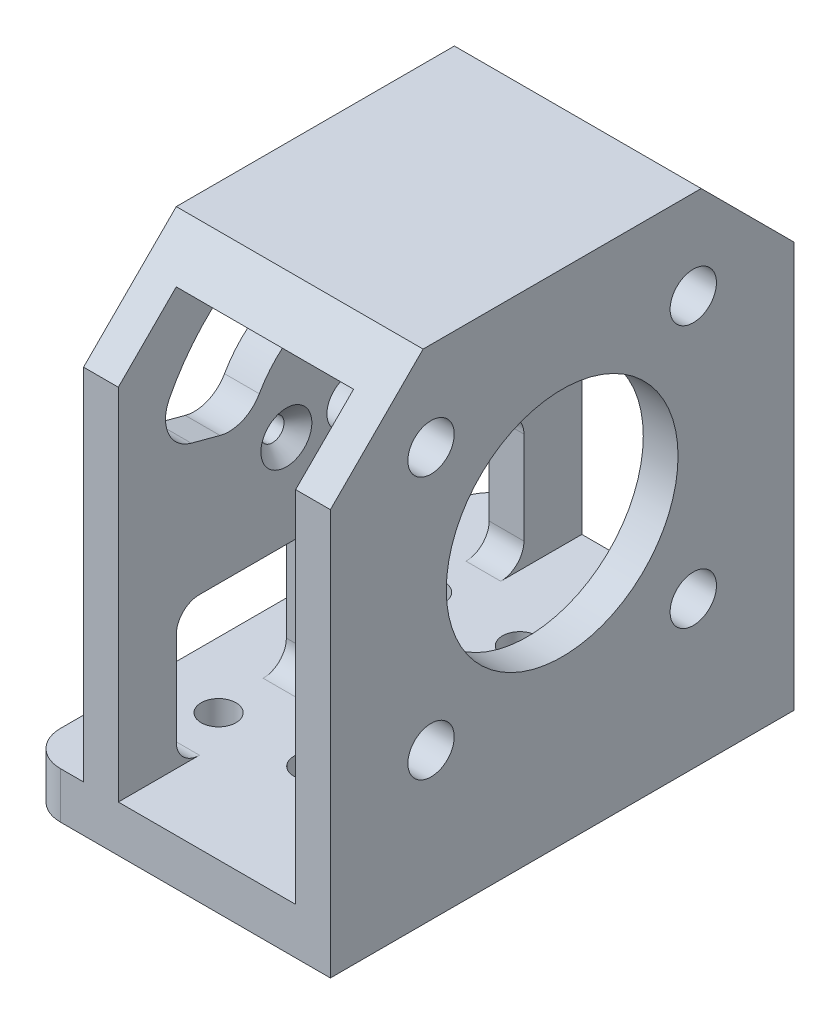
from build123d import *

# Parameters (mm, degrees)
SKETCH_1_W          = 21.3
SKETCH_1_H          = 40
EXTRUDE_1_DEPTH     = 4
SKETCH_2_W          = 3
SKETCH_2_H          = 40
EXTRUDE_2_DEPTH     = 36
SKETCH_3_W          = 21.3
SKETCH_3_H          = 40
EXTRUDE_3_DEPTH     = 3
CUT_EXTRUDE_1_REACH = 53.987
SKETCH_4_R          = 10
CUT_EXTRUDE_2_DEPTH = 52.98740232
SKETCH_13_W         = 40
SKETCH_13_H         = 4
EXTRUDE_4_DEPTH     = 5
SKETCH_6_R          = 1.5
CUT_EXTRUDE_3_DEPTH = 47.539472494
SKETCH_7_R          = 2
CUT_EXTRUDE_4_DEPTH = 4
SKETCH_9_R          = 2
SKETCH_9_R_2        = 1
CUT_EXTRUDE_6_DEPTH = 4
CUT_EXTRUDE_7_DEPTH = 4
FILLET_1_R          = 3
SKETCH_11_W         = 12.5
SKETCH_11_H         = 12
CUT_EXTRUDE_8_DEPTH = 3
FILLET_2_R          = 2
SKETCH_12_R         = 1
CUT_EXTRUDE_9_DEPTH = 3
CHAMFER_1_SIZE      = 1.2
FILLET_3_R          = 3


with BuildPart() as part:
    # 草图1 → 凸台-拉伸1 (new body)
    with BuildSketch(Plane(origin=(0, 0, 0), x_dir=(1, 0, 0), z_dir=(0, 1, 0))):
        Rectangle(SKETCH_1_W, SKETCH_1_H)
    extrude(amount=EXTRUDE_1_DEPTH)

    # 草图2 → 凸台-拉伸2 (add)
    with BuildSketch(Plane(origin=(0, 4, 0), x_dir=(1, 0, 0), z_dir=(0, 1, 0))):
        with Locations((-9.15, 0)):
            Rectangle(SKETCH_2_W, SKETCH_2_H)
        with Locations((9.15, 0)):
            Rectangle(SKETCH_2_W, SKETCH_2_H)
    extrude(amount=EXTRUDE_2_DEPTH)

    # 草图3 → 凸台-拉伸3 (add)
    with BuildSketch(Plane(origin=(0, 40, 0), x_dir=(1, 0, 0), z_dir=(0, 1, 0))):
        Rectangle(SKETCH_3_W, SKETCH_3_H)
    extrude(amount=EXTRUDE_3_DEPTH)

    # 草图4 → 切除-拉伸1 (cut, up to next)
    with BuildSketch(Plane(origin=(10.65, 0, 0), x_dir=(0, 0, -1), z_dir=(1, 0, 0)), mode=Mode.PRIVATE) as cut_extrude_1_sk1:
        with Locations((0, 24)):
            Circle(SKETCH_4_R)
    cut_extrude_1_tool1 = extrude(cut_extrude_1_sk1.sketch, amount=-CUT_EXTRUDE_1_REACH, mode=Mode.PRIVATE) & part.part
    add(cut_extrude_1_tool1.solids().sort_by_distance((10.65, 24, 0))[0], mode=Mode.SUBTRACT)

    # 草图5 → 切除-拉伸2 (cut, through all)
    with BuildSketch(Plane(origin=(10.65, 0, 0), x_dir=(0, 0, -1), z_dir=(1, 0, 0))):
        Polygon((-20, 35), (-12, 43), (-20, 43), align=None)
        Polygon((20, 35), (20, 43), (12, 43), align=None)
    extrude(amount=-CUT_EXTRUDE_2_DEPTH, mode=Mode.SUBTRACT)

    # 草图13 → 凸台-拉伸4 (add)
    with BuildSketch(Plane.ZY.offset(10.65)):
        with Locations((0, 2)):
            Rectangle(SKETCH_13_W, SKETCH_13_H)
    extrude(amount=EXTRUDE_4_DEPTH)

    # 草图6 → 切除-拉伸3 (cut, through all)
    with BuildSketch(Plane(origin=(0, 4, 0), x_dir=(1, 0, 0), z_dir=(0, 1, 0))):
        with Locations(Location((-10, 9, 0), (0, 0, 270))):
            Circle(SKETCH_6_R)
        with Locations(Location((-2, 9, 0), (0, 0, 90))):
            Circle(SKETCH_6_R)
        with Locations(Location((-2, -9, 0), (0, 0, 270))):
            Circle(SKETCH_6_R)
        with Locations(Location((-10, -9, 0), (0, 0, 244.320711381))):
            Circle(SKETCH_6_R)
    extrude(amount=-CUT_EXTRUDE_3_DEPTH, mode=Mode.SUBTRACT)

    # 草图7 → 切除-拉伸4 (cut)
    with BuildSketch(Plane(origin=(10.65, 0, 0), x_dir=(0, 0, -1), z_dir=(1, 0, 0))):
        with Locations((-11.313708499, 35.313708499)):
            Circle(SKETCH_7_R)
        with Locations((11.313708499, 35.313708499)):
            Circle(SKETCH_7_R)
        with Locations((11.313708499, 12.686291501)):
            Circle(SKETCH_7_R)
        with Locations((-11.313708499, 12.686291501)):
            Circle(SKETCH_7_R)
    extrude(amount=-CUT_EXTRUDE_4_DEPTH, mode=Mode.SUBTRACT)

    # 草图9 → 切除-拉伸6 (cut)
    with BuildSketch(Plane.ZY.offset(10.65)):
        with Locations((0, 24)):
            Circle(SKETCH_9_R)
        with Locations((-5.5, 24)):
            Circle(SKETCH_9_R_2)
        with Locations((5.5, 24)):
            Circle(SKETCH_9_R_2)
    extrude(amount=-CUT_EXTRUDE_6_DEPTH, mode=Mode.SUBTRACT)

    # 草图10 → 切除-拉伸7 (cut)
    with BuildSketch(Plane.ZY.offset(10.65)):
        with BuildLine():
            Line((-2.329371406, 32.693332437), (-4.529333289, 40.90370196))
            ThreePointArc((-4.529333289, 40.90370196), (-12.374368671, 36.374368671), (-16.90370196, 28.529333289))
            Line((-16.90370196, 28.529333289), (-8.693332437, 26.329371406))
            ThreePointArc((-8.693332437, 26.329371406), (-6.363961031, 30.363961031), (-2.329371406, 32.693332437))
        make_face()
        with BuildLine():
            Line((2.329371406, 32.693332437), (4.529333289, 40.90370196))
            ThreePointArc((4.529333289, 40.90370196), (12.374368671, 36.374368671), (16.90370196, 28.529333289))
            Line((16.90370196, 28.529333289), (8.693332437, 26.329371406))
            ThreePointArc((8.693332437, 26.329371406), (6.363961031, 30.363961031), (2.329371406, 32.693332437))
        make_face()
    extrude(amount=-CUT_EXTRUDE_7_DEPTH, mode=Mode.SUBTRACT)

    # 圆角1
    # the kernel refuses this fillet: 3 mm, written as the material it adds along each edge
    with BuildSketch(Plane(origin=(-10.65, 26.329371406, -8.693332437), x_dir=(0, 0.9256147934109583, 0.37846697903355925), z_dir=(1, 0, 0)), Plane(origin=(-10.65, 32.693332437, 2.329371406), x_dir=(0, -0.3784669790335633, 0.925614793410957), z_dir=(1, 0, 0))) as fillet_1_piece_1:
        with BuildLine():
            CenterArc((2.646090142, -2.976089089), FILLET_1_R, 97.238756093, 75.522487814)
            Line((-0.329998947, -2.598076211), (0, 0))
            ThreePointArc((0, 0), (1.134038632, -0.071732734), (2.268077265, 0))
        make_face()
    extrude(amount=3)
    with BuildSketch(Plane(origin=(-10.65, 32.693332437, -2.329371406), x_dir=(0, 0.9659258262890681, -0.25881904510252196), z_dir=(1, 0, 0)), Plane(origin=(-10.65, 26.329371406, 8.693332437), x_dir=(0, 0.25881904510252085, 0.9659258262890684), z_dir=(1, 0, 0))) as fillet_1_piece_2:
        with BuildLine():
            CenterArc((2.618950039, -3), FILLET_1_R, 90, 75.522487814)
            ThreePointArc((-0.285787471, -2.25), (-0.071732734, -1.134038632), (0, 0))
            Line((0, 0), (2.618950039, 0))
        make_face()
    extrude(amount=3)
    with BuildSketch(Plane(origin=(-10.65, 28.529333289, 16.90370196), x_dir=(0, 0.9337662406897771, -0.3578835114224755), z_dir=(1, 0, 0))) as fillet_1_piece_3:
        with BuildLine():
            CenterArc((3.328398071, -2.983727989), FILLET_1_R, 84.02972802, 101.940543961)
            Line((0.344670082, -3.295765308), (0, 0))
            ThreePointArc((0, 0), (1.820217695, 0.094920065), (3.64043539, 0))
        make_face()
    extrude(amount=3)
    with BuildSketch(Plane(origin=(-10.65, 40.90370196, 4.529333289), x_dir=(0, -0.35788351142247776, 0.9337662406897762), z_dir=(1, 0, 0))) as fillet_1_piece_4_section:
        with BuildLine():
            CenterArc((3.328398071, 2.983727989), FILLET_1_R, 174.02972802, 101.940543961)
            Line((0.344670082, 3.295765308), (0, 0))
            ThreePointArc((0, 0), (1.820217695, -0.094920065), (3.64043539, 0))
        make_face()
    fillet_1_piece_4 = extrude(amount=4, mode=Mode.PRIVATE)
    fillet_1_piece_4 = split(fillet_1_piece_4, bisect_by=Plane(origin=(-7.65, 39.487850141, 4.896179804), z_dir=(-1, 0, 0)), keep=Keep.TOP, mode=Mode.PRIVATE)
    fillet_1_piece_4 = split(fillet_1_piece_4, bisect_by=Plane(origin=(-9.15, 40, 4.896179804), z_dir=(0, -1, 0)), keep=Keep.TOP, mode=Mode.PRIVATE)
    add(fillet_1_piece_4)
    with BuildSketch(Plane(origin=(-10.65, 40.90370196, 4.529333289), x_dir=(0, -0.35788351142247776, 0.9337662406897762), z_dir=(1, 0, 0))) as fillet_1_piece_5_section:
        with BuildLine():
            CenterArc((3.328398071, 2.983727989), FILLET_1_R, 174.02972802, 101.940543961)
            Line((0.344670082, 3.295765308), (0, 0))
            ThreePointArc((0, 0), (1.820217695, -0.094920065), (3.64043539, 0))
        make_face()
    fillet_1_piece_5 = extrude(amount=4, mode=Mode.PRIVATE)
    fillet_1_piece_5 = split(fillet_1_piece_5, bisect_by=Plane(origin=(-7.65, 40.338801321, 5.357941996), z_dir=(-1, 0, 0)), keep=Keep.TOP, mode=Mode.PRIVATE)
    fillet_1_piece_5 = split(fillet_1_piece_5, bisect_by=Plane(origin=(-9.15, 40, 5.357941996), z_dir=(0, 1, 0)), keep=Keep.TOP, mode=Mode.PRIVATE)
    add(fillet_1_piece_5)
    with BuildSketch(Plane(origin=(-10.65, 40.90370196, 4.529333289), x_dir=(0, -0.35788351142247776, 0.9337662406897762), z_dir=(1, 0, 0))) as fillet_1_piece_6_section:
        with BuildLine():
            CenterArc((3.328398071, 2.983727989), FILLET_1_R, 174.02972802, 101.940543961)
            Line((0.344670082, 3.295765308), (0, 0))
            ThreePointArc((0, 0), (1.820217695, -0.094920065), (3.64043539, 0))
        make_face()
    fillet_1_piece_6 = extrude(amount=4, mode=Mode.PRIVATE)
    fillet_1_piece_6 = split(fillet_1_piece_6, bisect_by=Plane(origin=(-7.65, 40.338801321, 5.357941996), z_dir=(1, 0, 0)), keep=Keep.TOP, mode=Mode.PRIVATE)
    fillet_1_piece_6 = split(fillet_1_piece_6, bisect_by=Plane(origin=(-7.15, 40, 5.357941996), z_dir=(0, 1, 0)), keep=Keep.TOP, mode=Mode.PRIVATE)
    add(fillet_1_piece_6)
    with BuildSketch(Plane(origin=(-10.65, 40.90370196, 4.529333289), x_dir=(0, -0.35788351142247776, 0.9337662406897762), z_dir=(1, 0, 0))) as fillet_1_piece_7_section:
        with BuildLine():
            CenterArc((3.328398071, 2.983727989), FILLET_1_R, 174.02972802, 101.940543961)
            Line((0.344670082, 3.295765308), (0, 0))
            ThreePointArc((0, 0), (1.820217695, -0.094920065), (3.64043539, 0))
        make_face()
    fillet_1_piece_7 = extrude(amount=13.101088476, mode=Mode.PRIVATE)
    fillet_1_piece_7 = split(fillet_1_piece_7, bisect_by=Plane(origin=(-2.099455762, 40, 5.357941996), z_dir=(0, 1, 0)), keep=Keep.TOP, mode=Mode.PRIVATE)
    fillet_1_piece_7 = split(fillet_1_piece_7, bisect_by=Plane(origin=(-6.65, 40.338801321, 5.357941996), z_dir=(1, 0, 0)), keep=Keep.TOP, mode=Mode.PRIVATE)
    add(fillet_1_piece_7)
    with BuildSketch(Plane(origin=(-10.65, 40.90370196, -4.529333289), x_dir=(0, -0.9659258262890679, 0.25881904510252246), z_dir=(1, 0, 0))) as fillet_1_piece_8_section:
        with BuildLine():
            CenterArc((3.313739041, 3), FILLET_1_R, 168.059456039, 101.940543961)
            ThreePointArc((0.378650567, 3.620689655), (0.094920065, 1.820217695), (0, 0))
            Line((0, 0), (3.313739041, 0))
        make_face()
    fillet_1_piece_8 = extrude(amount=4, mode=Mode.PRIVATE)
    fillet_1_piece_8 = split(fillet_1_piece_8, bisect_by=Plane(origin=(-7.65, 39.487850141, -4.896179804), z_dir=(-1, 0, 0)), keep=Keep.TOP, mode=Mode.PRIVATE)
    fillet_1_piece_8 = split(fillet_1_piece_8, bisect_by=Plane(origin=(-9.15, 40, -4.896179804), z_dir=(0, -1, 0)), keep=Keep.TOP, mode=Mode.PRIVATE)
    add(fillet_1_piece_8)
    with BuildSketch(Plane(origin=(-10.65, 40.90370196, -4.529333289), x_dir=(0, -0.9659258262890679, 0.25881904510252246), z_dir=(1, 0, 0))) as fillet_1_piece_9_section:
        with BuildLine():
            CenterArc((3.313739041, 3), FILLET_1_R, 168.059456039, 101.940543961)
            ThreePointArc((0.378650567, 3.620689655), (0.094920065, 1.820217695), (0, 0))
            Line((0, 0), (3.313739041, 0))
        make_face()
    fillet_1_piece_9 = extrude(amount=4, mode=Mode.PRIVATE)
    fillet_1_piece_9 = split(fillet_1_piece_9, bisect_by=Plane(origin=(-7.65, 40.338801321, -5.357941996), z_dir=(-1, 0, 0)), keep=Keep.TOP, mode=Mode.PRIVATE)
    fillet_1_piece_9 = split(fillet_1_piece_9, bisect_by=Plane(origin=(-9.15, 40, -5.357941996), z_dir=(0, 1, 0)), keep=Keep.TOP, mode=Mode.PRIVATE)
    add(fillet_1_piece_9)
    with BuildSketch(Plane(origin=(-10.65, 40.90370196, -4.529333289), x_dir=(0, -0.9659258262890679, 0.25881904510252246), z_dir=(1, 0, 0))) as fillet_1_piece_10_section:
        with BuildLine():
            CenterArc((3.313739041, 3), FILLET_1_R, 168.059456039, 101.940543961)
            ThreePointArc((0.378650567, 3.620689655), (0.094920065, 1.820217695), (0, 0))
            Line((0, 0), (3.313739041, 0))
        make_face()
    fillet_1_piece_10 = extrude(amount=4, mode=Mode.PRIVATE)
    fillet_1_piece_10 = split(fillet_1_piece_10, bisect_by=Plane(origin=(-7.65, 40.338801321, -5.357941996), z_dir=(1, 0, 0)), keep=Keep.TOP, mode=Mode.PRIVATE)
    fillet_1_piece_10 = split(fillet_1_piece_10, bisect_by=Plane(origin=(-7.15, 40, -5.357941996), z_dir=(0, 1, 0)), keep=Keep.TOP, mode=Mode.PRIVATE)
    add(fillet_1_piece_10)
    with BuildSketch(Plane(origin=(-10.65, 40.90370196, -4.529333289), x_dir=(0, -0.9659258262890679, 0.25881904510252246), z_dir=(1, 0, 0))) as fillet_1_piece_11_section:
        with BuildLine():
            CenterArc((3.313739041, 3), FILLET_1_R, 168.059456039, 101.940543961)
            ThreePointArc((0.378650567, 3.620689655), (0.094920065, 1.820217695), (0, 0))
            Line((0, 0), (3.313739041, 0))
        make_face()
    fillet_1_piece_11 = extrude(amount=13.101088476, mode=Mode.PRIVATE)
    fillet_1_piece_11 = split(fillet_1_piece_11, bisect_by=Plane(origin=(-6.65, 40.338801321, -5.357941996), z_dir=(1, 0, 0)), keep=Keep.TOP, mode=Mode.PRIVATE)
    fillet_1_piece_11 = split(fillet_1_piece_11, bisect_by=Plane(origin=(-2.099455762, 40, -5.357941996), z_dir=(0, 1, 0)), keep=Keep.TOP, mode=Mode.PRIVATE)
    add(fillet_1_piece_11)
    with BuildSketch(Plane(origin=(-10.65, 28.529333289, -16.90370196), x_dir=(0, -0.25881904510252, 0.9659258262890684), z_dir=(1, 0, 0))) as fillet_1_piece_12:
        with BuildLine():
            CenterArc((3.313739041, -3), FILLET_1_R, 90, 101.940543961)
            ThreePointArc((0.378650567, -3.620689655), (0.094920065, -1.820217695), (0, 0))
            Line((0, 0), (3.313739041, 0))
        make_face()
    extrude(amount=3)

    # 草图11 → 切除-拉伸8 (cut)
    with BuildSketch(Plane.ZY.offset(10.65)):
        with Locations((-8.75, 10)):
            Rectangle(SKETCH_11_W, SKETCH_11_H)
        with Locations((8.75, 10)):
            Rectangle(SKETCH_11_W, SKETCH_11_H)
    extrude(amount=-CUT_EXTRUDE_8_DEPTH, mode=Mode.SUBTRACT)

    # 圆角2
    fillet_2_edges = [part.edges().sort_by_distance(p)[0] for p in [
        (-9.15, 4, -2.5),
        (-9.15, 4, -15),
        (-9.15, 16, -15),
        (-9.15, 16, -2.5),
        (-9.15, 4, 15),
        (-9.15, 16, 15),
        (-9.15, 4, 2.5),
        (-9.15, 16, 2.5),
    ]]
    fillet(fillet_2_edges, radius=FILLET_2_R)

    # 草图12 → 切除-拉伸9 (cut)
    with BuildSketch(Plane.ZY.offset(10.65)):
        with Locations((0, 29.75)):
            Circle(SKETCH_12_R)
        with Locations((0, 18.25)):
            Circle(SKETCH_12_R)
    extrude(amount=-CUT_EXTRUDE_9_DEPTH, mode=Mode.SUBTRACT)

    # 倒角1
    chamfer_1_edges = [part.edges().sort_by_distance(p)[0] for p in [
        (-7.65, 24, 4.5),
        (-7.65, 24, -6.5),
        (-7.65, 29.75, -1),
        (-7.65, 18.25, -1),
    ]]
    chamfer(chamfer_1_edges, length=CHAMFER_1_SIZE)

    # 圆角3
    fillet_3_edges = [part.edges().sort_by_distance(p)[0] for p in [
        (-15.65, 2, -20),
        (-15.65, 2, 20),
    ]]
    fillet(fillet_3_edges, radius=FILLET_3_R)


solid = part.part
